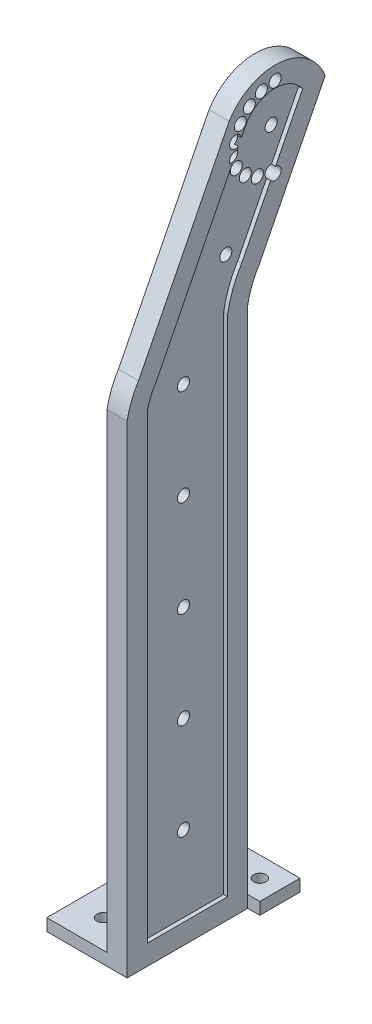
from build123d import *

# Parameters (mm, degrees)
SKETCH_1_R          = 1.5
EXTRUDE_2_DEPTH     = 5
CUT_EXTRUDE_1_DEPTH = 1
EXTRUDE_3_DEPTH     = 3
SKETCH_6_R          = 1.55
CUT_EXTRUDE_2_DEPTH = 10
SKETCH_7_W          = 3
SKETCH_7_H          = 41
EXTRUDE_4_DEPTH     = 13
EXTRUDE_5_DEPTH     = 3
SKETCH_10_R         = 1.6
CUT_EXTRUDE_3_DEPTH = 3


with BuildPart() as part:
    # 草图1 → 凸台-拉伸2 (new body)
    with BuildSketch(Plane(origin=(0, 0, 0), x_dir=(0, 0, -1), z_dir=(1, 0, 0))):
        with BuildLine():
            Line((-15, 0), (15, 0))
            Line((15, 0), (15, 130))
            ThreePointArc((15, 130), (16.060667235, 133.763397528), (17.833287426, 137.248507798))
            Line((17.833287426, 137.248507798), (34.277601095, 169.80605943))
            ThreePointArc((34.277601095, 169.80605943), (22.969406924, 178.256928012), (10.37531975, 171.878730504))
            Line((10.37531975, 171.878730504), (-12.166712574, 127.248507798))
            ThreePointArc((-12.166712574, 127.248507798), (-13.939332765, 123.763397528), (-15, 120))
            Line((-15, 120), (-15, 0))
        make_face()
        with Locations((0, 23.934052351)):
            Circle(SKETCH_1_R, mode=Mode.SUBTRACT)
        with Locations((0, 47.934052351)):
            Circle(SKETCH_1_R, mode=Mode.SUBTRACT)
        with Locations((0, 71.934052351)):
            Circle(SKETCH_1_R, mode=Mode.SUBTRACT)
        with Locations((0, 95.934052351)):
            Circle(SKETCH_1_R, mode=Mode.SUBTRACT)
        with Locations((10.541707006, 142.602806473)):
            Circle(SKETCH_1_R, mode=Mode.SUBTRACT)
        with Locations((0, 119.934052351)):
            Circle(SKETCH_1_R, mode=Mode.SUBTRACT)
        with Locations((21.812723168, 164.917917825)):
            Circle(SKETCH_1_R, mode=Mode.SUBTRACT)
        with Locations((11.964645637, 166.654399602)):
            Circle(SKETCH_1_R, mode=Mode.SUBTRACT)
        with Locations((11.964645637, 163.181436049)):
            Circle(SKETCH_1_R, mode=Mode.SUBTRACT)
        with Locations((13.15246913, 159.917917825)):
            Circle(SKETCH_1_R, mode=Mode.SUBTRACT)
        with Locations((15.384847071, 157.257473394)):
            Circle(SKETCH_1_R, mode=Mode.SUBTRACT)
        with Locations((18.392521734, 155.520991617)):
            Circle(SKETCH_1_R, mode=Mode.SUBTRACT)
        with Locations((21.812723168, 154.917917825)):
            Circle(SKETCH_1_R, mode=Mode.SUBTRACT)
        with Locations((13.15246913, 169.917917825)):
            Circle(SKETCH_1_R, mode=Mode.SUBTRACT)
        with Locations((15.384847071, 172.578362256)):
            Circle(SKETCH_1_R, mode=Mode.SUBTRACT)
        with Locations((18.392521734, 174.314844033)):
            Circle(SKETCH_1_R, mode=Mode.SUBTRACT)
        with Locations((21.812723168, 174.917917825)):
            Circle(SKETCH_1_R, mode=Mode.SUBTRACT)
    extrude(amount=-EXTRUDE_2_DEPTH)

    # 草图4 → 切除-拉伸1 (cut)
    with BuildSketch(Plane(origin=(0, 0, 0), x_dir=(0, 0, -1), z_dir=(1, 0, 0))):
        with BuildLine():
            Line((-10, 5), (10, 5))
            Line((10, 5), (10, 130.418298195))
            ThreePointArc((10, 130.418298195), (11.272736422, 135.241025308), (13.477541954, 139.715104809))
            Line((13.477541954, 139.715104809), (28.657153069, 169.768713769))
            ThreePointArc((28.657153069, 169.768713769), (21.607154469, 173.304465594), (14.73885303, 169.427552317))
            Line((14.73885303, 169.427552317), (-7.82549521, 124.753147068))
            ThreePointArc((-7.82549521, 124.753147068), (-9.161705076, 122.242477333), (-10, 119.524724411))
            Line((-10, 119.524724411), (-10, 5))
        make_face()
    extrude(amount=-CUT_EXTRUDE_1_DEPTH, mode=Mode.SUBTRACT)

    # 草图5 → 凸台-拉伸3 (add)
    with BuildSketch(Plane(origin=(0, 0, 0), x_dir=(-1, 0, 0), z_dir=(0, -1, 0))):
        Polygon((0, -15), (20, -15), (20, 15), (20, 25), (-3, 25), (-3, 15), (0, 15), align=None)
    extrude(amount=-EXTRUDE_3_DEPTH)

    # 草图6 → 切除-拉伸2 (cut)
    with BuildSketch(Plane.XZ):
        with Locations((-13, 8)):
            Circle(SKETCH_6_R)
        with Locations((-2, -20)):
            Circle(SKETCH_6_R)
        with Locations((-13, -3)):
            Circle(SKETCH_6_R)
    extrude(amount=-CUT_EXTRUDE_2_DEPTH, mode=Mode.SUBTRACT)

    # 草图7 → 凸台-拉伸4 (add)
    with BuildSketch(Plane.ZY.offset(5)):
        with Locations((-10.3, 23.5)):
            Rectangle(SKETCH_7_W, SKETCH_7_H)
    extrude(amount=EXTRUDE_4_DEPTH)

    # 草图9 → 凸台-拉伸5 (add)
    with BuildSketch(Plane(origin=(0, 0, -11.8), x_dir=(-1, 0, 0), z_dir=(0, 0, -1))):
        with BuildLine():
            Line((5, 44), (18, 44))
            ThreePointArc((18, 44), (11.5, 50.5), (5, 44))
        make_face()
    extrude(amount=-EXTRUDE_5_DEPTH)

    # 草图10 → 切除-拉伸3 (cut)
    with BuildSketch(Plane(origin=(0, 0, -11.8), x_dir=(-1, 0, 0), z_dir=(0, 0, -1))):
        with Locations((11.5, 44)):
            Circle(SKETCH_10_R)
        with Locations((11.5, 7)):
            Circle(SKETCH_10_R)
    extrude(amount=-CUT_EXTRUDE_3_DEPTH, mode=Mode.SUBTRACT)


solid = part.part
